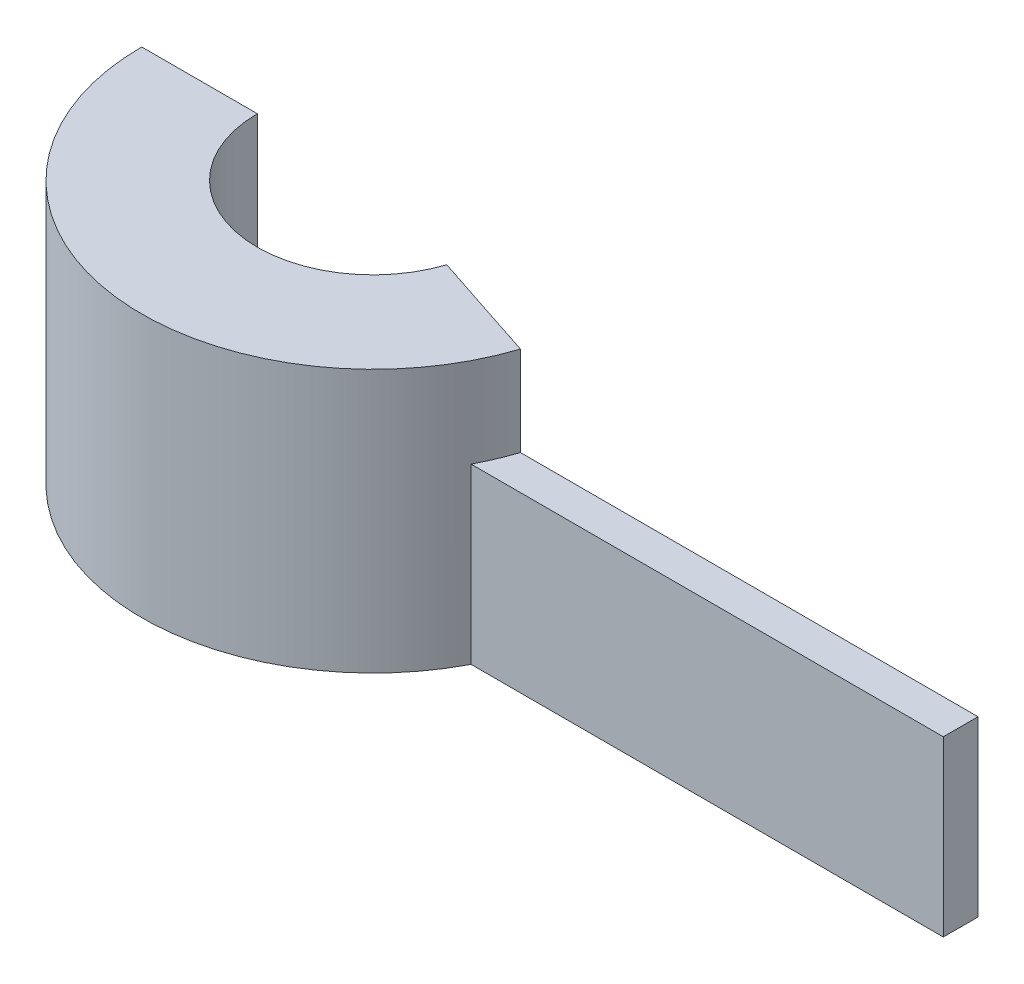
from build123d import *

# Parameters (mm, degrees)
SKETCH1_W              = 2.756398936
SKETCH1_H              = 15
REVOLVE2_ANGLE         = 180
BOSS_EXTRUDE1_START    = 6.25
SKETCH1_7_W            = 41.323169176
SKETCH1_7_H            = 15
BOSS_EXTRUDE1_DEPTH    = 3
CUT_REVOLVE2_START     = -9.499177596
CUT_REVOLVE2_OUTLINE_W = 22.75
CUT_REVOLVE2_OUTLINE_H = 7
CUT_REVOLVE2_DEPTH     = 29.499177596


with BuildPart() as part:
    # Sketch1 → Revolve2 (revolve)
    with BuildSketch(Plane.XY):
        Polygon((17.243601064, 9), (20, 9), (20, 16.75), (10, 16.75), (10, 2.5), (0, 2.5), (0, -6), (17.243601064, -6), align=None)
        with Locations((18.621800532, 1.5)):
            Rectangle(SKETCH1_W, SKETCH1_H)
    revolve(axis=Axis((0, 2.5, 0), (0, -1, 0)), revolution_arc=REVOLVE2_ANGLE)

    # Sketch1<7> → Boss-Extrude1 (add)
    with BuildSketch(Plane.XY.offset(BOSS_EXTRUDE1_START)):
        with Locations((37.905185652, 1.5)):
            Rectangle(SKETCH1_7_W, SKETCH1_7_H)
    extrude(amount=BOSS_EXTRUDE1_DEPTH)

    # Cut-Revolve2: read off the stored shape, not the designer's step
    # Cut-Revolve2 outline → Cut-Revolve2 (cut)
    with BuildSketch(Plane(origin=(0, 0, 0), x_dir=(0, 1, 0), z_dir=(0.9499177595981665, 0, 0.31250000000000017)).offset(CUT_REVOLVE2_START)):
        with Locations((5.375, -3.5)):
            Rectangle(CUT_REVOLVE2_OUTLINE_W, CUT_REVOLVE2_OUTLINE_H)
    extrude(amount=CUT_REVOLVE2_DEPTH, mode=Mode.SUBTRACT)


solid = part.part
